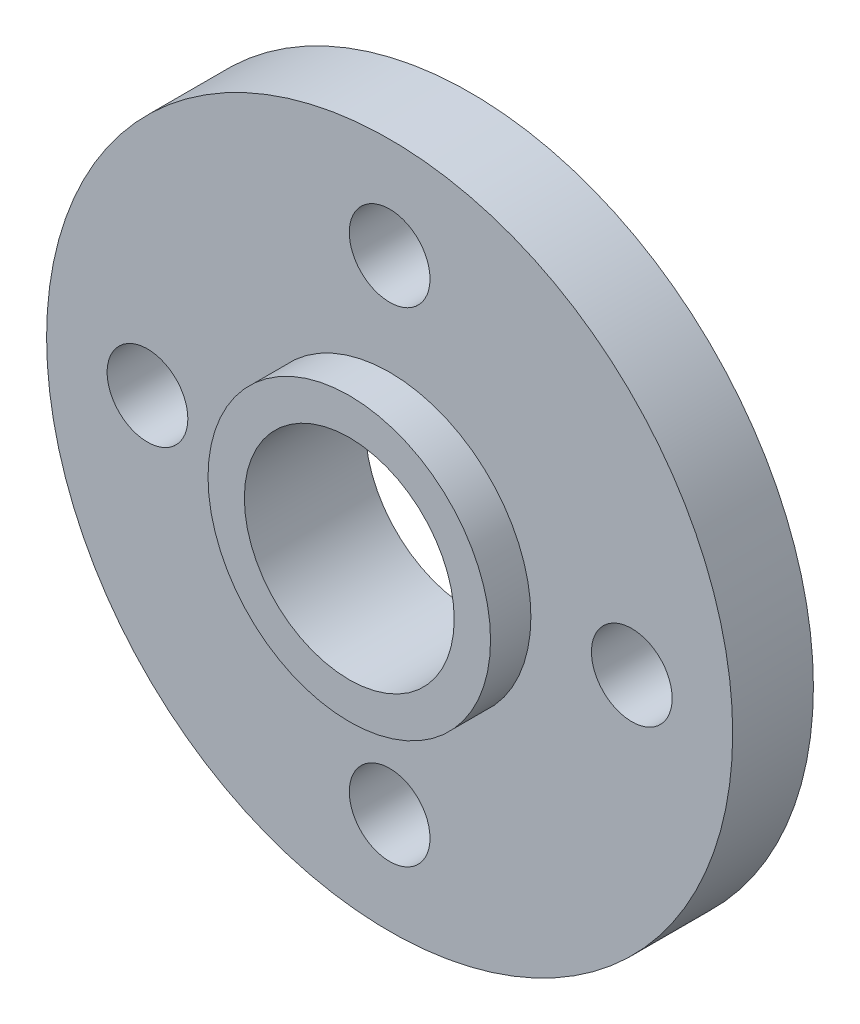
from build123d import *

# Parameters (mm, degrees)
SKETCH_2_R      = 8.5
SKETCH_2_R_2    = 2.6
SKETCH_2_R_3    = 1
EXTRUDE_1_DEPTH = 2
SKETCH_3_R      = 3.5
SKETCH_3_R_2    = 2.6
EXTRUDE_2_DEPTH = 1


with BuildPart() as part:
    # Эскиз2 → Бобышка-Вытянуть1 (new body)
    with BuildSketch(Plane.XY):
        Circle(SKETCH_2_R)
        Circle(SKETCH_2_R_2, mode=Mode.SUBTRACT)
        with Locations((-6, 0)):
            Circle(SKETCH_2_R_3, mode=Mode.SUBTRACT)
        with Locations((0, 6)):
            Circle(SKETCH_2_R_3, mode=Mode.SUBTRACT)
        with Locations((6, 0)):
            Circle(SKETCH_2_R_3, mode=Mode.SUBTRACT)
        with Locations((0, -6)):
            Circle(SKETCH_2_R_3, mode=Mode.SUBTRACT)
    extrude(amount=EXTRUDE_1_DEPTH)

    # Эскиз3 → Бобышка-Вытянуть2 (add)
    with BuildSketch(Plane.XY.offset(2)):
        Circle(SKETCH_3_R)
        Circle(SKETCH_3_R_2, mode=Mode.SUBTRACT)
    extrude(amount=EXTRUDE_2_DEPTH)


solid = part.part
